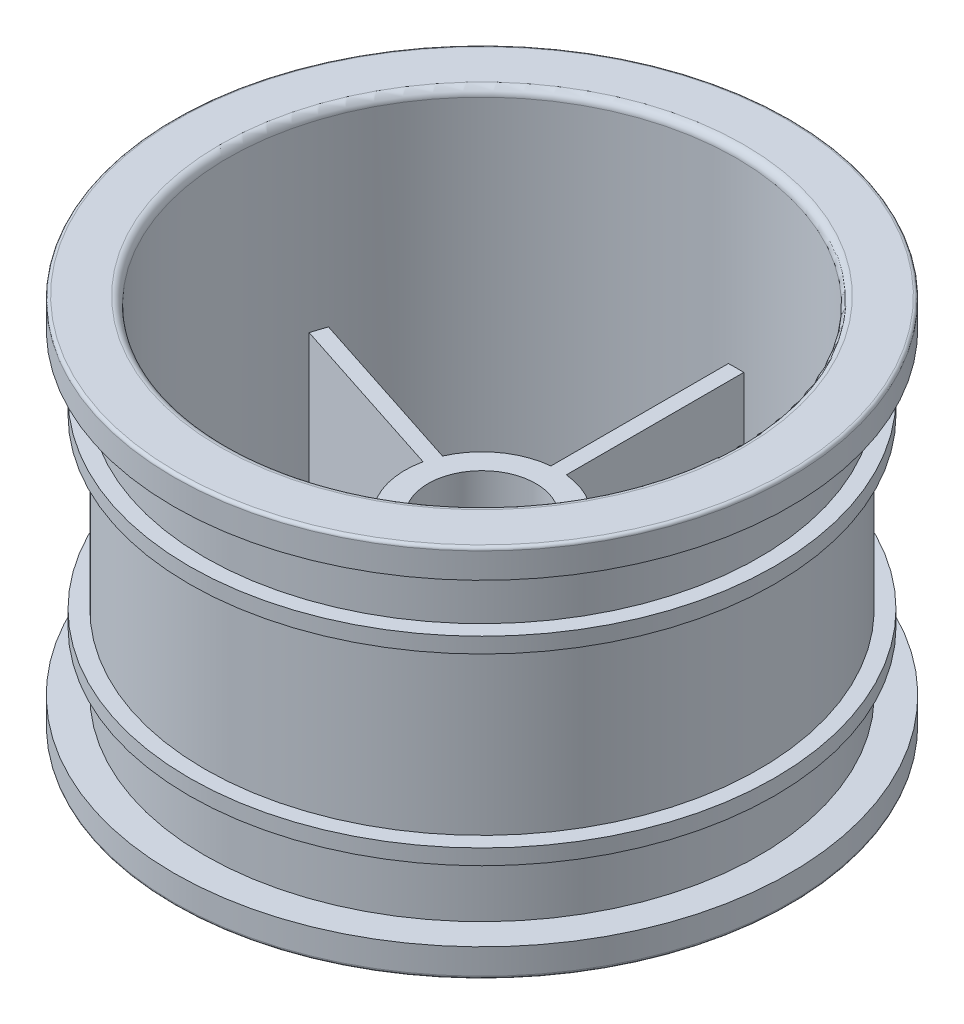
from build123d import *
from build123d.topology import SkipClean

# Parameters (mm, degrees)
CUT_EXTRUDE_3_REACH            = 42.725
CUT_EXTRUDE_3_END_MAJOR_RADIUS = 16.923430924
CUT_EXTRUDE_3_END_MINOR_RADIUS = 48.081501594
PATTERN_CIRCULAR_2_COUNT       = 5
SKETCH_11_R                    = 1.75
CUT_EXTRUDE_4_DEPTH            = 38.382773157
PATTERN_CIRCULAR_3_COUNT       = 5
EXTRUDE_START                  = -9.5000001
EXTRUDE_1_DEPTH                = 9.5000001
PATTERN_CIRCULAR_4_COUNT       = 5
SKETCH_14_R                    = 3.5
CUT_EXTRUDE_5_DEPTH            = 2
CUT_EXTRUDE_START              = -2.2
SKETCH_15_R                    = 3.5
CUT_EXTRUDE_6_DEPTH            = 2.2


# Read off the part's stored shape, not the designer's step: 凸台-拉伸1
with BuildPart() as part:
    # 草图1 → 旋转1 (revolve)
    with BuildSketch(Plane.XY, mode=Mode.PRIVATE) as revolve_1_sk:
        with BuildLine():
            Line((-20, 24.1), (-20, 22.45))
            Line((-20, 22.45), (-18, 22.45))
            Line((-18, 22.45), (-18, 18.6))
            Line((-18, 18.6), (-19, 18.6))
            Line((-19, 18.6), (-19, 17.6))
            Line((-19, 17.6), (-18, 17.6))
            Line((-18, 17.6), (-18, 6.7))
            Line((-18, 6.7), (-19, 6.7))
            Line((-19, 6.7), (-19, 5.7))
            Line((-19, 5.7), (-18, 5.7))
            Line((-18, 5.7), (-18, 1.85))
            Line((-18, 1.85), (-20, 1.85))
            Line((-20, 1.85), (-20, 0.2))
            ThreePointArc((-20, 0.2), (-19.941421356, 0.058578644), (-19.8, 0))
            Line((-19.8, 0), (-17, 0))
            ThreePointArc((-17, 0), (-16.646446609, 0.146446609), (-16.5, 0.5))
            Line((-16.5, 0.5), (-16.5, 23.8))
            ThreePointArc((-16.5, 23.8), (-16.646446609, 24.153553391), (-17, 24.3))
            Line((-17, 24.3), (-19.8, 24.3))
            ThreePointArc((-19.8, 24.3), (-19.941421356, 24.241421356), (-20, 24.1))
        make_face()
    revolve(revolve_1_sk.sketch.rotate(Axis((0, 0, 0), (0, 1, 0)), 270), axis=Axis((0, 0, 0), (0, 1, 0)))

    # 草图9 → 旋转3 (revolve)
    with BuildSketch(Plane(origin=(0, 0, 0), x_dir=(0, 0, -1), z_dir=(1, 0, 0)), mode=Mode.PRIVATE) as revolve_3_sk:
        with BuildLine():
            Line((-16.5, 0.5), (-16.5, 2.5))
            ThreePointArc((-16.5, 2.5), (-10.704608739, 2.902000329), (-5, 4))
            Line((-5, 4), (-5, 12))
            Line((-5, 12), (-3.5, 12))
            Line((-3.5, 12), (-2, 12))
            Line((-2, 12), (-2, 1.8))
            Line((-2, 1.8), (-3.5, 1.8))
            ThreePointArc((-3.5, 1.8), (-5.037844716, 1.166624577), (-6.5, 0.374013246))
            ThreePointArc((-6.5, 0.374013246), (-11.700835545, -1.193230007), (-17, 0))
            ThreePointArc((-17, 0), (-16.646446609, 0.146446609), (-16.5, 0.5))
        make_face()
    revolve(revolve_3_sk.sketch.rotate(Axis((0, 0, 0), (0, 1, 0)), 180), axis=Axis((0, 0, 0), (0, 1, 0)))

    # 切除-拉伸3: up to this torus (the profile starts outside it)
    cut_extrude_3_end = Plane(origin=(0, 50.579637081, 0), z_dir=(0, -1, 0)) * Torus(CUT_EXTRUDE_3_END_MAJOR_RADIUS, CUT_EXTRUDE_3_END_MINOR_RADIUS, mode=Mode.PRIVATE)
    # 草图10 → 切除-拉伸3 (cut, up to the surface)
    with BuildSketch(Plane(origin=(0, -5, 0), x_dir=(1, 0, 0), z_dir=(0, 1, 0)), mode=Mode.PRIVATE) as cut_extrude_3_sk1:
        with BuildLine():
            ThreePointArc((1.561424643, -8.626404343), (0, -8), (-1.561424643, -8.626404343))
            ThreePointArc((-1.561424643, -8.626404343), (-4.286474535, -11.515143576), (-6.7, -14.668809077))
            ThreePointArc((-6.7, -14.668809077), (-6.741658569, -14.935945599), (-6.562789857, -15.13868519))
            ThreePointArc((-6.562789857, -15.13868519), (0, -16.5), (6.562789857, -15.13868519))
            ThreePointArc((6.562789857, -15.13868519), (6.741658569, -14.935945599), (6.7, -14.668809077))
            ThreePointArc((6.7, -14.668809077), (4.286474535, -11.515143576), (1.561424643, -8.626404343))
        make_face()
    cut_extrude_3_tool1 = extrude(cut_extrude_3_sk1.sketch, amount=CUT_EXTRUDE_3_REACH, mode=Mode.PRIVATE) - cut_extrude_3_end
    cut_extrude_3 = cut_extrude_3_tool1.solids().sort_by_distance((0, -5, 12.982743))[0]
    add(cut_extrude_3, mode=Mode.SUBTRACT)

    # 阵列(圆周)2: 切除-拉伸3 ×5 about axis
    with SkipClean():  # the faces are left unmerged after this step: merging them gives an invalid solid
        pattern_circular_2_axis = Axis((0, 0, 0), (0, 1, 0))
        for i in range(1, PATTERN_CIRCULAR_2_COUNT):
            add(cut_extrude_3.rotate(pattern_circular_2_axis, i * 360 / PATTERN_CIRCULAR_2_COUNT), mode=Mode.SUBTRACT)

    # 草图11 → 切除-拉伸4 (cut, through all, along a direction that is not the sketch's normal)
    with SkipClean():  # the faces are left unmerged after this step: merging them gives an invalid solid
        with BuildSketch(Plane.XY):
            with Locations((0, -1.2)):
                Circle(SKETCH_11_R)
        cut_extrude_4 = extrude(amount=-CUT_EXTRUDE_4_DEPTH, dir=(0, 0.06975647374412546, 0.9975640502598242), mode=Mode.SUBTRACT)

    # 阵列(圆周)3: 切除-拉伸4 ×5 about axis
    with SkipClean():  # the faces are left unmerged after this step: merging them gives an invalid solid
        pattern_circular_3_axis = Axis((0, 0, 0), (0, 1, 0))
        for i in range(1, PATTERN_CIRCULAR_3_COUNT):
            add(cut_extrude_4.rotate(pattern_circular_3_axis, i * 360 / PATTERN_CIRCULAR_3_COUNT), mode=Mode.SUBTRACT)

    # 凸台-拉伸1 outline → 凸台-拉伸1 (add)
    with SkipClean():  # the faces are left unmerged after this step: merging them gives an invalid solid
        with BuildSketch(Plane(origin=(0, 12, 0), x_dir=(1, 0, 0), z_dir=(0, 1, 0)).offset(EXTRUDE_START)):
            with BuildLine():
                ThreePointArc((3.328703206, -3.730916103), (2.938926262, -4.045084972), (2.519686212, -4.318701355))
                Line((2.519686212, -4.318701355), (9.289494224, -13.636542709))
                ThreePointArc((9.289494224, -13.636542709), (9.698456663, -13.348780407), (10.098511219, -13.048757457))
                Line((10.098511219, -13.048757457), (3.328703206, -3.730916103))
            make_face()
        extrude_1 = extrude(amount=EXTRUDE_1_DEPTH)

    # 阵列(圆周)4: 凸台-拉伸1 ×5 about axis
    with SkipClean():  # the faces are left unmerged after this step: merging them gives an invalid solid
        pattern_circular_4_axis = Axis((0, 0, 0), (0, 1, 0))
        for i in range(1, PATTERN_CIRCULAR_4_COUNT):
            add(extrude_1.rotate(pattern_circular_4_axis, i * 360 / PATTERN_CIRCULAR_4_COUNT))

    # 草图14 → 切除-拉伸5 (cut)
    with SkipClean():  # the faces are left unmerged after this step: merging them gives an invalid solid
        with BuildSketch(Plane.XZ.offset(-1.8)):
            with Locations(Location((0, 0, 0), (0, 0, 270))):
                Circle(SKETCH_14_R)
        extrude(amount=-CUT_EXTRUDE_5_DEPTH, mode=Mode.SUBTRACT)

    # 草图15 → 切除-拉伸6 (cut)
    with SkipClean():  # the faces are left unmerged after this step: merging them gives an invalid solid
        with BuildSketch(Plane(origin=(0, 12, 0), x_dir=(1, 0, 0), z_dir=(0, 1, 0)).offset(CUT_EXTRUDE_START)):
            with Locations(Location((0, 0, 0), (0, 0, 90))):
                Circle(SKETCH_15_R)
        extrude(amount=CUT_EXTRUDE_6_DEPTH, mode=Mode.SUBTRACT)


solid = part.part
